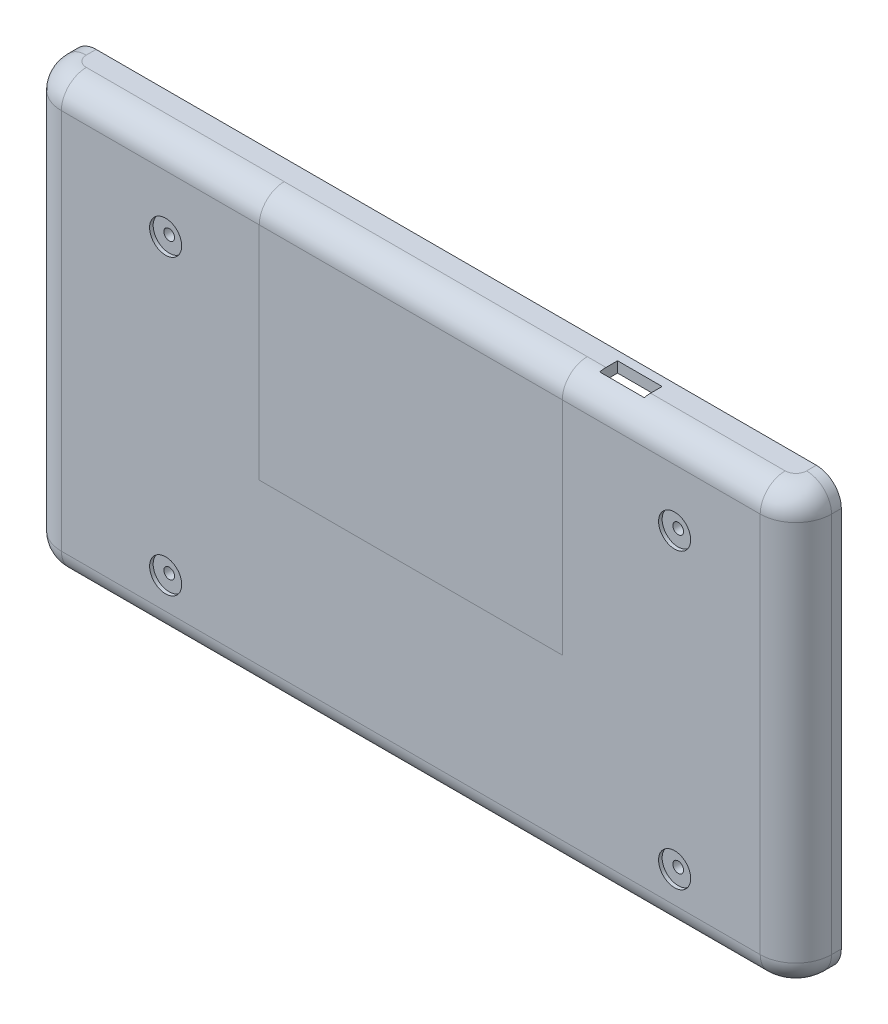
from build123d import *

# Parameters (mm, degrees)
SKETCH_1_W             = 210
SKETCH_1_H             = 115
EXTRUDE_6_DEPTH        = 9.75
FILLET_6_R             = 7
FILLET_7_R             = 4
SHELL_6_T              = 3
SKETCH_17_R            = 4.5
SKETCH_17_R_2          = 1.5
CUT_EXTRUDE_2_DEPTH    = 1
SKETCH_20_R            = 1.5
CUT_EXTRUDE_3_DEPTH    = 125.446022435
SKETCH_12_R            = 4.5
SKETCH_12_R_2          = 1.5
EXTRUDE_12_DEPTH       = 9
SKETCH_21_W            = 12.5
SKETCH_21_H            = 5
CUT_EXTRUDE_4_DEPTH    = 10
SPLIT_START            = -42.5
SPLIT_BODIES_4_DEPTH   = 85
SPLIT_BODIES_4_2_DEPTH = 85


# Read off the part's stored shape, not the designer's step: Разделить4
with BuildPart() as part:
    # Эскиз1 → Бобышка-Вытянуть6 (new body)
    with BuildSketch(Plane.XY):
        Rectangle(SKETCH_1_W, SKETCH_1_H)
    extrude(amount=EXTRUDE_6_DEPTH)

    # Скругление6
    fillet_6_edges = [part.edges().sort_by_distance(p)[0] for p in [
        (105, 0, 9.75),
        (-105, 0, 9.75),
    ]]
    fillet(fillet_6_edges, radius=FILLET_6_R)

    # Скругление7
    fillet_7_edges = [part.edges().sort_by_distance(p)[0] for p in [
        (0, -57.5, 9.75),
        (0, 57.5, 9.75),
        (-105, 57.5, 1.375),
        (105, 57.5, 1.375),
        (-102.949747468, 57.5, 7.699747468),
        (102.949747468, 57.5, 7.699747468),
        (105, -57.5, 1.375),
        (-105, -57.5, 1.375),
        (-102.949747468, -57.5, 7.699747468),
        (102.949747468, -57.5, 7.699747468),
    ]]
    fillet(fillet_7_edges, radius=FILLET_7_R)

    # Оболочка6
    shell_6_openings = [part.faces().sort_by_distance(p)[0] for p in [
        (0, 0, 0),
    ]]
    offset(amount=SHELL_6_T, openings=shell_6_openings, kind=Kind.INTERSECTION)

    # Эскиз17 → Вырез-Вытянуть2 (cut)
    # profile 1 of 4: a face of its own
    with BuildSketch(Plane.XY.offset(12.75)):
        with Locations((73.99553429, 37.5)):
            Circle(SKETCH_17_R)
        with Locations((73.99553429, 37.5)):
            Circle(SKETCH_17_R_2, mode=Mode.SUBTRACT)
    # profile 2 of 4: a face of its own
    with BuildSketch(Plane.XY.offset(12.75)):
        with Locations((-68.75446571, 37.5)):
            Circle(SKETCH_17_R)
        with Locations((-68.75446571, 37.5)):
            Circle(SKETCH_17_R_2, mode=Mode.SUBTRACT)
    # profile 3 of 4: a face of its own
    with BuildSketch(Plane.XY.offset(12.75)):
        with Locations((73.99553429, -44.75)):
            Circle(SKETCH_17_R)
        with Locations((73.99553429, -44.75)):
            Circle(SKETCH_17_R_2, mode=Mode.SUBTRACT)
    # profile 4 of 4: a face of its own
    with BuildSketch(Plane.XY.offset(12.75)):
        with Locations((-68.75446571, -44.75)):
            Circle(SKETCH_17_R)
        with Locations((-68.75446571, -44.75)):
            Circle(SKETCH_17_R_2, mode=Mode.SUBTRACT)
    extrude(amount=-CUT_EXTRUDE_2_DEPTH, mode=Mode.SUBTRACT)

    # Эскиз20 → Вырез-Вытянуть3 (cut, through all)
    with BuildSketch(Plane.XY.offset(12.75)):
        with Locations((-68.75446571, 37.5)):
            Circle(SKETCH_20_R)
        with Locations((73.99553429, 37.5)):
            Circle(SKETCH_20_R)
        with Locations((73.99553429, -44.75)):
            Circle(SKETCH_20_R)
        with Locations((-68.75446571, -44.75)):
            Circle(SKETCH_20_R)
    extrude(amount=-CUT_EXTRUDE_3_DEPTH, mode=Mode.SUBTRACT)

    # Эскиз12 → Бобышка-Вытянуть12 (add)
    # profile 1 of 4: a face of its own
    with BuildSketch(Plane(origin=(0, 0, 9.75), x_dir=(-1, 0, 0), z_dir=(0, 0, -1))):
        with Locations(Location((68.75446571, 37.5, 0), (0, 0, 180))):
            Circle(SKETCH_12_R)
        with Locations(Location((68.75446571, 37.5, 0), (0, 0, 180))):
            Circle(SKETCH_12_R_2, mode=Mode.SUBTRACT)
    # profile 2 of 4: a face of its own
    with BuildSketch(Plane(origin=(0, 0, 9.75), x_dir=(-1, 0, 0), z_dir=(0, 0, -1))):
        with Locations(Location((-73.99553429, 37.5, 0), (0, 0, 180))):
            Circle(SKETCH_12_R)
        with Locations(Location((-73.99553429, 37.5, 0), (0, 0, 180))):
            Circle(SKETCH_12_R_2, mode=Mode.SUBTRACT)
    # profile 3 of 4: a face of its own
    with BuildSketch(Plane(origin=(0, 0, 9.75), x_dir=(-1, 0, 0), z_dir=(0, 0, -1))):
        with Locations(Location((68.75446571, -44.75, 0), (0, 0, 180))):
            Circle(SKETCH_12_R)
        with Locations(Location((68.75446571, -44.75, 0), (0, 0, 180))):
            Circle(SKETCH_12_R_2, mode=Mode.SUBTRACT)
    # profile 4 of 4: a face of its own
    with BuildSketch(Plane(origin=(0, 0, 9.75), x_dir=(-1, 0, 0), z_dir=(0, 0, -1))):
        with Locations(Location((-73.99553429, -44.75, 0), (0, 0, 180))):
            Circle(SKETCH_12_R)
        with Locations(Location((-73.99553429, -44.75, 0), (0, 0, 180))):
            Circle(SKETCH_12_R_2, mode=Mode.SUBTRACT)
    extrude(amount=EXTRUDE_12_DEPTH)

    # Эскиз21 → Вырез-Вытянуть4 (cut)
    with BuildSketch(Plane(origin=(0, 60.5, 0), x_dir=(1, 0, 0), z_dir=(0, 1, 0))):
        with Locations((54, -5)):
            Rectangle(SKETCH_21_W, SKETCH_21_H)
    extrude(amount=-CUT_EXTRUDE_4_DEPTH, mode=Mode.SUBTRACT)

    # Split Bodies 4 2 outline → Split Bodies 4 2 (cut)
    with BuildSketch(Plane.YZ.offset(SPLIT_START)):
        with BuildLine():
            Line((-8.5, 12.75), (-8.5, 9.75))
            Line((-8.5, 9.75), (53.5, 9.75))
            ThreePointArc((53.5, 9.75), (56.328427125, 8.578427125), (57.5, 5.75))
            Line((57.5, 5.75), (60.5, 5.75))
            ThreePointArc((60.5, 5.75), (58.449747468, 10.699747468), (53.5, 12.75))
            Line((53.5, 12.75), (-8.5, 12.75))
        make_face()
    extrude(amount=SPLIT_BODIES_4_2_DEPTH, mode=Mode.SUBTRACT)


with BuildPart() as body_2:
    # Split Bodies 4 outline → Split Bodies 4 (new body)
    with BuildSketch(Plane.YZ.offset(SPLIT_START)):
        with BuildLine():
            Line((57.5, 5.75), (60.5, 5.75))
            ThreePointArc((60.5, 5.75), (58.449747468, 10.699747468), (53.5, 12.75))
            Line((53.5, 12.75), (-8.5, 12.75))
            Line((-8.5, 12.75), (-8.5, 9.75))
            Line((-8.5, 9.75), (53.5, 9.75))
            ThreePointArc((53.5, 9.75), (56.328427125, 8.578427125), (57.5, 5.75))
        make_face()
    extrude(amount=SPLIT_BODIES_4_DEPTH)


solid = Compound([part.part, body_2.part])
